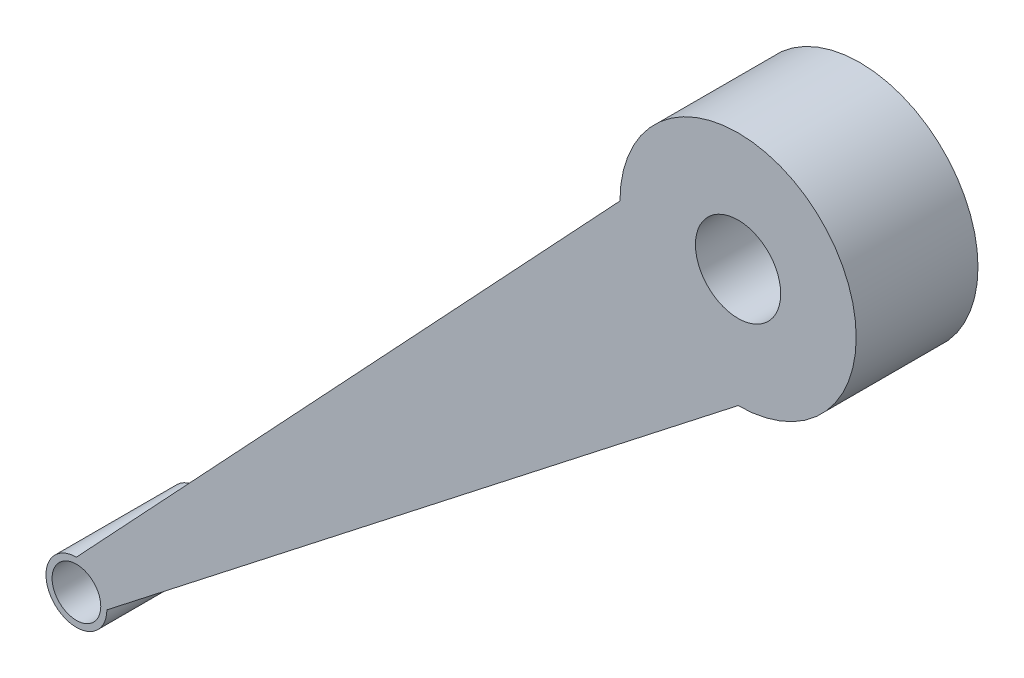
from build123d import *

# Parameters (mm, degrees)
SALIENTE_EXTRUIR2_DEPTH = 10
CROQUIS2_R              = 2
CORTAR_EXTRUIR1_DEPTH   = 90.57535888
SALIENTE_EXTRUIR3_START = -5
SALIENTE_EXTRUIR3_DEPTH = 5
CROQUIS4_R              = 3.5
CORTAR_EXTRUIR2_DEPTH   = 10


with BuildPart() as part:
    # Croquis1 → Saliente-Extruir2 (new body)
    with BuildSketch(Plane.XY):
        with BuildLine():
            Line((44.628418222, 52.139361077), (0, 4.5))
            ThreePointArc((0, 4.5), (-1.767766953, 0.232233047), (2.5, 2))
            Line((2.5, 2), (54.328418222, 42.439361077))
            ThreePointArc((54.328418222, 42.439361077), (61.187353999, 58.998296855), (44.628418222, 52.139361077))
        make_face()
        with BuildLine():
            Line((53.992751033, 43.445838918), (2.255737897, 3.077797078))
            ThreePointArc((2.255737897, 3.077797078), (1.78485494, 3.750512166), (1.121414308, 4.234374622))
            Line((1.121414308, 4.234374622), (45.636989072, 51.753279039))
            ThreePointArc((45.636989072, 51.753279039), (60.462381656, 58.309003902), (53.992751033, 43.445838918))
        make_face(mode=Mode.SUBTRACT)
    extrude(amount=SALIENTE_EXTRUIR2_DEPTH)

    # Croquis2 → Cortar-Extruir1 (cut, through all)
    with BuildSketch(Plane.XY.offset(10)):
        with Locations((0, 2)):
            Circle(CROQUIS2_R)
    extrude(amount=-CORTAR_EXTRUIR1_DEPTH, mode=Mode.SUBTRACT)

    # Croquis3 → Saliente-Extruir3 (add)
    with BuildSketch(Plane.XY.offset(10).offset(SALIENTE_EXTRUIR3_START)):
        with BuildLine():
            Line((45.636989072, 51.753279039), (1.121414308, 4.234374622))
            ThreePointArc((1.121414308, 4.234374622), (1.78485494, 3.750512166), (2.255737897, 3.077797078))
            Line((2.255737897, 3.077797078), (53.992751033, 43.445838918))
            ThreePointArc((53.992751033, 43.445838918), (60.462381656, 58.309003902), (45.636989072, 51.753279039))
        make_face()
    extrude(amount=SALIENTE_EXTRUIR3_DEPTH)

    # Croquis4 → Cortar-Extruir2 (cut)
    with BuildSketch(Plane(origin=(0, 0, 5), x_dir=(-1, 0, 0), z_dir=(0, 0, -1))):
        with Locations((-54.328418222, 52.139361077)):
            Circle(CROQUIS4_R)
    extrude(amount=-CORTAR_EXTRUIR2_DEPTH, mode=Mode.SUBTRACT)


solid = part.part
